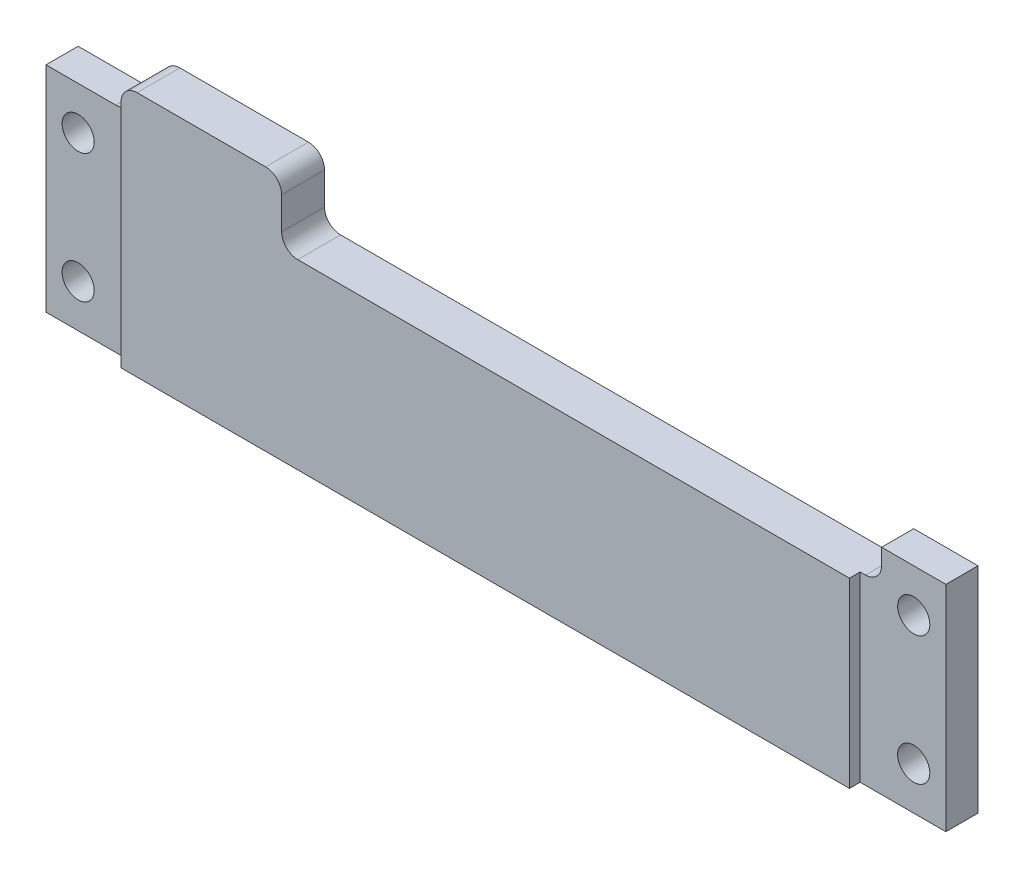
from build123d import *

# Parameters (mm, degrees)
SKETCH1_R           = 1.5
BOSS_EXTRUDE1_DEPTH = 4
SKETCH2_W           = 8
SKETCH2_H           = 20
CUT_EXTRUDE1_DEPTH  = 1
FILLET1_R           = 1.5


with BuildPart() as part:
    # Sketch1 → Boss-Extrude1 (new body)
    with BuildSketch(Plane.XY):
        Polygon((23, 23), (23, 17), (78, 17), (78, 20), (84, 20), (84, 0), (0, 0), (0, 20), (8, 20), (8, 23), align=None)
        with Locations((3, 16)):
            Circle(SKETCH1_R, mode=Mode.SUBTRACT)
        with Locations((81, 16)):
            Circle(SKETCH1_R, mode=Mode.SUBTRACT)
        with Locations((3, 4)):
            Circle(SKETCH1_R, mode=Mode.SUBTRACT)
        with Locations((81, 4)):
            Circle(SKETCH1_R, mode=Mode.SUBTRACT)
    extrude(amount=BOSS_EXTRUDE1_DEPTH)

    # Sketch2 → Cut-Extrude1 (cut)
    with BuildSketch(Plane.XY.offset(4)):
        with Locations((4, 10)):
            Rectangle(SKETCH2_W, SKETCH2_H)
        with Locations((80, 10)):
            Rectangle(SKETCH2_W, SKETCH2_H)
    extrude(amount=-CUT_EXTRUDE1_DEPTH, mode=Mode.SUBTRACT)

    # Fillet1
    fillet1_edges = [part.edges().sort_by_distance(p)[0] for p in [
        (78, 17, 1.5),
        (23, 17, 2),
        (23, 23, 2),
        (8, 23, 2),
        (8, 20, 1.5),
    ]]
    fillet(fillet1_edges, radius=FILLET1_R - 0.0001)  # a hair under: the kernel refuses the full size


solid = part.part
